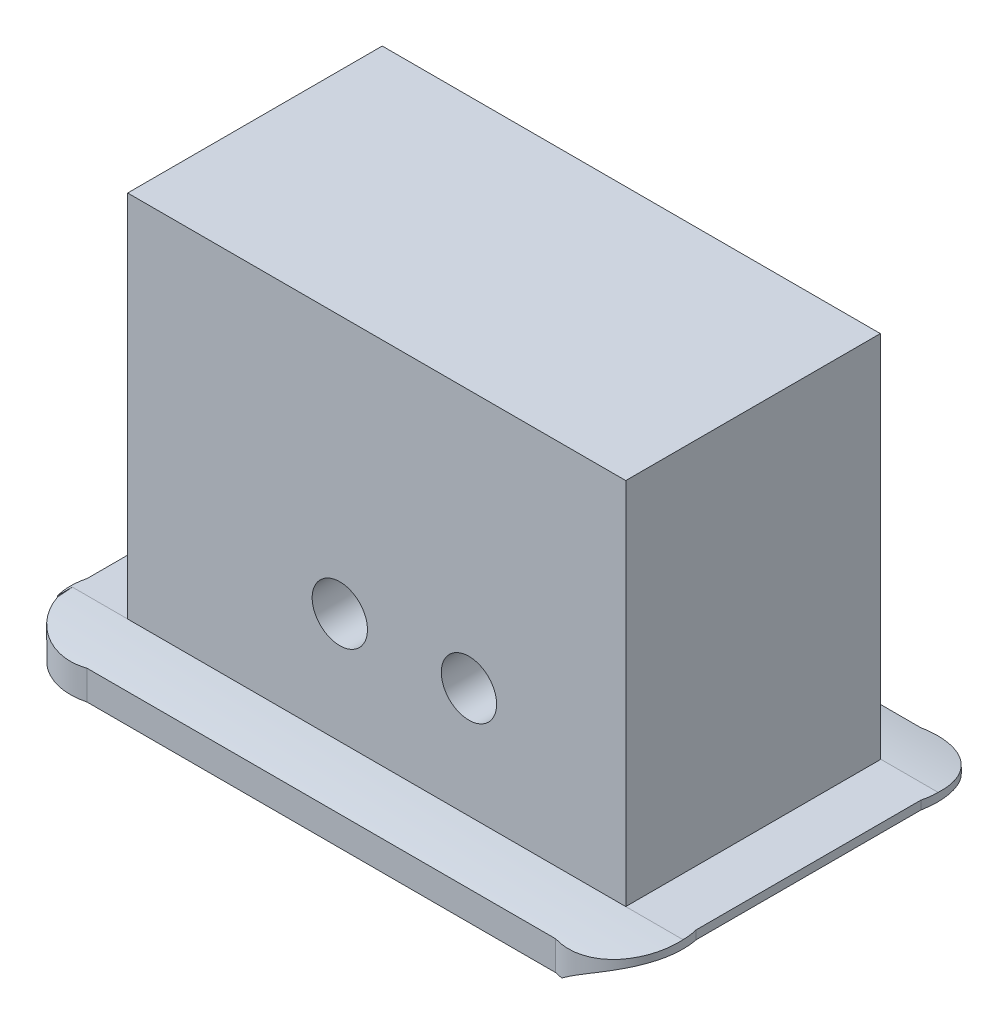
from build123d import *

# Parameters (mm, degrees)
SKETCH1_W               = 27
SKETCH1_H               = 13.8
SKETCH1_W_2             = 21
SKETCH1_H_2             = 7.8
BOSS_EXTRUDE1_DEPTH     = 22
SKETCH3_W               = 21
SKETCH3_H               = 7.8
BOSS_EXTRUDE2_DEPTH     = 2
SKETCH6_W               = 27
SKETCH6_H               = 13.8
BOSS_EXTRUDE3_DEPTH     = 2
SKETCH8_R               = 3
CUT_EXTRUDE2_DEPTH      = 5
CUT_EXTRUDE3_DEPTH      = 45
CUT_EXTRUDE5_DEPTH      = 45
CUT_EXTRUDE5_DEPTH_BACK = 45
CUT_EXTRUDE6_DEPTH      = 39.787182551
CUT_EXTRUDE6_DEPTH_BACK = 39.787182551
SKETCH7_R               = 1.5


with BuildPart() as part:
    # Sketch1 → Boss-Extrude1 (new body)
    with BuildSketch(Plane(origin=(0, 0, 0), x_dir=(1, 0, 0), z_dir=(0, 1, 0))):
        with Locations((10.5, 3.9)):
            Rectangle(SKETCH1_W, SKETCH1_H)
        with Locations((10.5, 3.9)):
            Rectangle(SKETCH1_W_2, SKETCH1_H_2, mode=Mode.SUBTRACT)
    extrude(amount=BOSS_EXTRUDE1_DEPTH)

    # Sketch3 → Boss-Extrude2 (add)
    with BuildSketch(Plane(origin=(0, 22, 0), x_dir=(1, 0, 0), z_dir=(0, 1, 0))):
        with Locations((10.5, 3.9)):
            Rectangle(SKETCH3_W, SKETCH3_H)
    extrude(amount=-BOSS_EXTRUDE2_DEPTH)

    # Sketch6 → Boss-Extrude3 (add)
    with BuildSketch(Plane.XZ):
        with BuildLine():
            Line((-6, 2.2), (-6, -10))
            ThreePointArc((-6, -10), (-5.19544984, -12.99544984), (-2.2, -13.8))
            Line((-2.2, -13.8), (23.2, -13.8))
            ThreePointArc((23.2, -13.8), (26.19544984, -12.99544984), (27, -10))
            Line((27, -10), (27, 2.2))
            ThreePointArc((27, 2.2), (26.19544984, 5.19544984), (23.2, 6))
            Line((23.2, 6), (-2.2, 6))
            ThreePointArc((-2.2, 6), (-5.19544984, 5.19544984), (-6, 2.2))
        make_face()
        with Locations((10.5, -3.9)):
            Rectangle(SKETCH6_W, SKETCH6_H, mode=Mode.SUBTRACT)
    extrude(amount=-BOSS_EXTRUDE3_DEPTH)

    # Sketch8 → Cut-Extrude2 (cut)
    with BuildSketch(Plane.ZY.offset(3)):
        with Locations((-3.9, 16.816542633)):
            Circle(SKETCH8_R)
    extrude(amount=-CUT_EXTRUDE2_DEPTH, mode=Mode.SUBTRACT)

    # Sketch12 → Cut-Extrude3 (cut)
    with BuildSketch(Plane.ZY.offset(6)):
        with BuildLine():
            Line((3, 2), (6.104834939, 2))
            Line((6.104834939, 2), (6.104834939, 1.56677659))
            add(Edge.make_bspline(
                [(6.104834939, 1.56677659), (4.570942596, 1.898546139), (3, 2)],
                knots=[0, 0, 0, 1, 1, 1], degree=2))
        make_face()
        with BuildLine():
            Line((-13.933772202, 2), (-13.933772202, 1.56677659))
            add(Edge.make_bspline(
                [(-13.933772202, 1.56677659), (-12.399879859, 1.898546139), (-10.828937263, 2)],
                knots=[0, 0, 0, 1, 1, 1], degree=2))
            Line((-10.828937263, 2), (-13.933772202, 2))
        make_face()
    extrude(amount=-CUT_EXTRUDE3_DEPTH, mode=Mode.SUBTRACT)

    # Sketch13 → Cut-Extrude5 (cut, two sides: drawn at the far end of the back side and taken through both)
    with BuildSketch(Plane(origin=(27, 0, -10), x_dir=(1, 0, 0), z_dir=(0, 0, 1)).offset(-CUT_EXTRUDE5_DEPTH_BACK)):
        with BuildLine():
            Line((-3.377880941, 0), (0.509598996, 0))
            Line((0.509598996, 0), (0.509598996, 1.57572602))
            Line((0.509598996, 1.57572602), (0.175576118, 1.57572602))
            add(Edge.make_bspline(
                [(-3.377880941, 0), (-2.337490472, 0.807111843), (-1.090367189, 1.274012221), (0.175576118, 1.57572602)],
                knots=[0, 0, 0, 0, 1, 1, 1, 1], degree=3))
        make_face()
    extrude(amount=CUT_EXTRUDE5_DEPTH + CUT_EXTRUDE5_DEPTH_BACK, mode=Mode.SUBTRACT)

    # Sketch7 → Cut-Extrude6 (cut, two sides: drawn at the far end of the back side and taken through both)
    with BuildSketch(Plane(origin=(0, 0, -10.8), x_dir=(-1, 0, 0), z_dir=(0, 0, -1)).offset(-CUT_EXTRUDE6_DEPTH_BACK)):
        with Locations((-15.5, 8)):
            Circle(SKETCH7_R)
        with Locations((-8.5, 8)):
            Circle(SKETCH7_R)
    extrude(amount=CUT_EXTRUDE6_DEPTH + CUT_EXTRUDE6_DEPTH_BACK, mode=Mode.SUBTRACT)


solid = part.part
